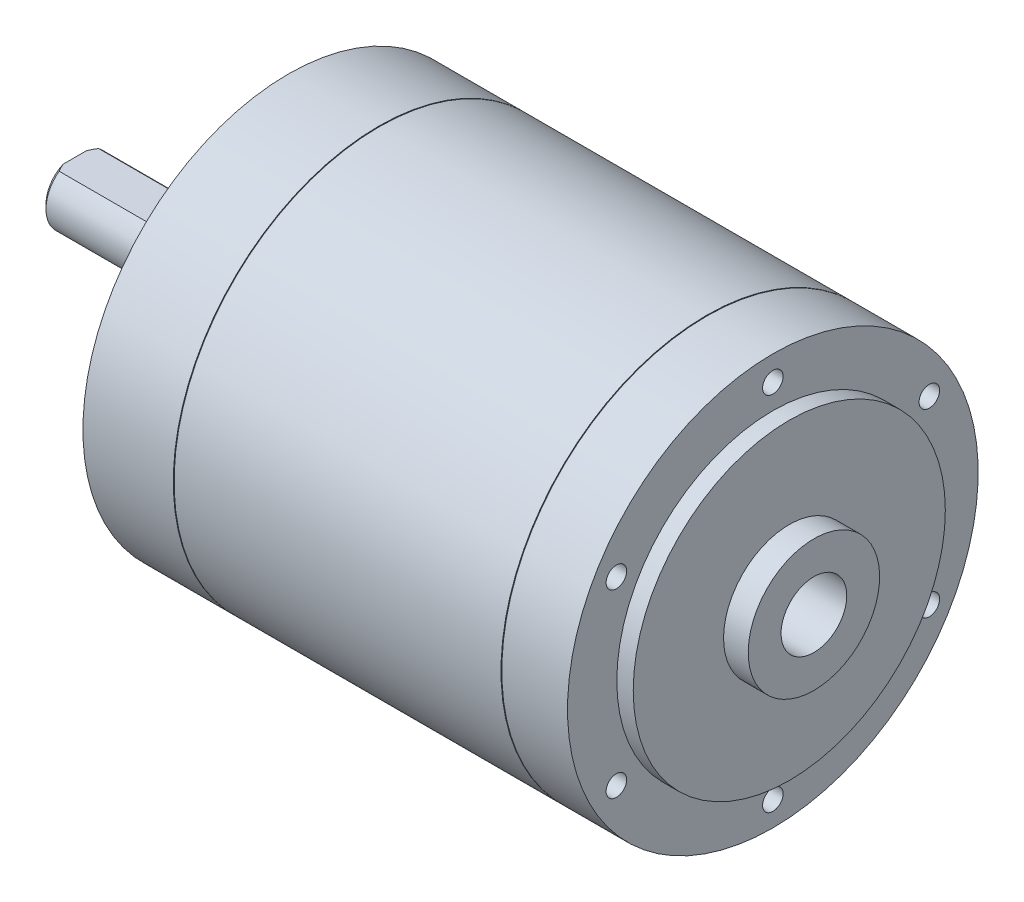
from build123d import *

# Parameters (mm, degrees)
COQUE2_START                 = -56
COQUE2_OUTLINE_R             = 16.9
COQUE2_DEPTH                 = 43
COQUE2_START_2               = -59
COQUE2_2_OUTLINE_R           = 7
COQUE2_2_DEPTH               = 48
COQUE2_START_3               = -13
COQUE2_3_OUTLINE_R           = 11
COQUE2_3_OUTLINE_R_2         = 7
COQUE2_3_DEPTH               = 2
COQUE2_START_4               = -44.9
COQUE2_4_OUTLINE_R           = 17
COQUE2_4_OUTLINE_R_2         = 16.9
COQUE2_4_DEPTH               = 23.8
CHANFREIN1_SIZE              = 0.5
ESQUISSE6_R                  = 4
EXTRUSION1_DEPTH             = 10
ESQUISSE8_R                  = 4
EXTRUSION2_DEPTH             = 23
R_P_TITION_CIRCULAIRE1_COUNT = 6
CHANFREIN2_SIZE              = 0.5
EXTRUSION3_DEPTH             = 97.695398029
EXTRUSION3_DEPTH_BACK        = 97.695398029
ESQUISSE11_W                 = 21.903594892
ESQUISSE11_H                 = 3.021185502


# Read off the part's stored shape, not the designer's step: Coque2
with BuildPart() as part:
    # Esquisse1 → Base-Révolution (revolve)
    with BuildSketch(Plane.XY, mode=Mode.PRIVATE) as base_r_volution_sk:
        Polygon((-67, 0), (-67, 15), (-64, 15), (-64, 25), (-53, 25), (-53, 24.9), (-52.9, 24.9), (-52.9, 25), (-13.1, 25), (-13.1, 24.9), (-13, 24.9), (-13, 25), (-5, 25), (-5, 19), (-3, 19), (-3, 8), (0, 8), (0, 0), align=None)
    revolve(base_r_volution_sk.sketch.rotate(Axis((-92, 0, 0), (1, 0, 0)), 180), axis=Axis((-92, 0, 0), (1, 0, 0)))

    # Coque2 outline → Coque2 (cut)
    with BuildSketch(Plane.YZ.offset(COQUE2_START)):
        Circle(COQUE2_OUTLINE_R)
    extrude(amount=COQUE2_DEPTH, mode=Mode.SUBTRACT)

    # Coque2 2 outline → Coque2 2 (cut)
    with BuildSketch(Plane.YZ.offset(COQUE2_START_2)):
        Circle(COQUE2_2_OUTLINE_R)
    extrude(amount=COQUE2_2_DEPTH, mode=Mode.SUBTRACT)

    # Coque2 3 outline → Coque2 3 (cut)
    with BuildSketch(Plane.YZ.offset(COQUE2_START_3)):
        Circle(COQUE2_3_OUTLINE_R)
        Circle(COQUE2_3_OUTLINE_R_2, mode=Mode.SUBTRACT)
    extrude(amount=COQUE2_3_DEPTH, mode=Mode.SUBTRACT)

    # Coque2 4 outline → Coque2 4 (cut)
    with BuildSketch(Plane.YZ.offset(COQUE2_START_4)):
        Circle(COQUE2_4_OUTLINE_R)
        Circle(COQUE2_4_OUTLINE_R_2, mode=Mode.SUBTRACT)
    extrude(amount=COQUE2_4_DEPTH, mode=Mode.SUBTRACT)

    # Esquisse4 → Trou taraudé M5x0.81 (revolve, cut)
    with BuildSketch(Plane(origin=(-64, 20, 0), x_dir=(0, 0, 1), z_dir=(0, 1, 0))):
        Polygon((0, 0), (0, 15.212435565), (2.1, 14), (2.1, 0), align=None)
    trou_taraud_m5x0_81 = revolve(axis=Axis((-70.35, 20, 0), (1, 0, 0)), mode=Mode.SUBTRACT)

    # Chanfrein1
    chanfrein1_edges = [part.edges().sort_by_distance(p)[0] for p in [
        (-67, 15, 0),
    ]]
    chamfer(chanfrein1_edges, length=CHANFREIN1_SIZE)

    # Esquisse6 → Extrusion1 (cut)
    with BuildSketch(Plane(origin=(0, 0, 0), x_dir=(0, 0, -1), z_dir=(1, 0, 0))):
        with Locations(Location((0, 0, 0), (0, 0, 90))):
            Circle(ESQUISSE6_R)
    extrude(amount=-EXTRUSION1_DEPTH, mode=Mode.SUBTRACT)

    # Esquisse8 → Extrusion2 (add)
    with BuildSketch(Plane.ZY.offset(67)):
        with Locations(Location((0, 0, 0), (0, 0, 90))):
            Circle(ESQUISSE8_R)
    extrude(amount=EXTRUSION2_DEPTH)

    # Esquisse9 → Trou taraudé M31 (revolve, cut)
    with BuildSketch(Plane(origin=(-5, 22, 0), x_dir=(0, 0, -1), z_dir=(0, 1, 0))):
        Polygon((0, 0), (0, 8.251075774), (1.25, 7.5), (1.25, 0), align=None)
    trou_taraud_m31 = revolve(axis=Axis((1.35, 22, 0), (-1, 0, 0)), mode=Mode.SUBTRACT)

    # Répétition circulaire1: Trou taraudé M5x0.81, Trou taraudé M31 ×6 about axis
    r_p_tition_circulaire1_axis = Axis((0, 0, 0), (1, 0, 0))
    add([trou_taraud_m5x0_81.rotate(r_p_tition_circulaire1_axis, i * 360 / R_P_TITION_CIRCULAIRE1_COUNT) for i in range(1, R_P_TITION_CIRCULAIRE1_COUNT)], mode=Mode.SUBTRACT)
    add([trou_taraud_m31.rotate(r_p_tition_circulaire1_axis, i * 360 / R_P_TITION_CIRCULAIRE1_COUNT) for i in range(1, R_P_TITION_CIRCULAIRE1_COUNT)], mode=Mode.SUBTRACT)

    # Chanfrein2
    chanfrein2_edges = [part.edges().sort_by_distance(p)[0] for p in [
        (-90, -4, 0),
    ]]
    chamfer(chanfrein2_edges, length=CHANFREIN2_SIZE)

    # Esquisse11 → Extrusion3 (cut, two sides: drawn at the far end of the back side and taken through both)
    with BuildSketch(Plane.XY.offset(-EXTRUSION3_DEPTH_BACK)):
        with Locations((-80.650230715, 4.710592751)):
            Rectangle(ESQUISSE11_W, ESQUISSE11_H)
    extrude(amount=EXTRUSION3_DEPTH + EXTRUSION3_DEPTH_BACK, mode=Mode.SUBTRACT)


solid = part.part
